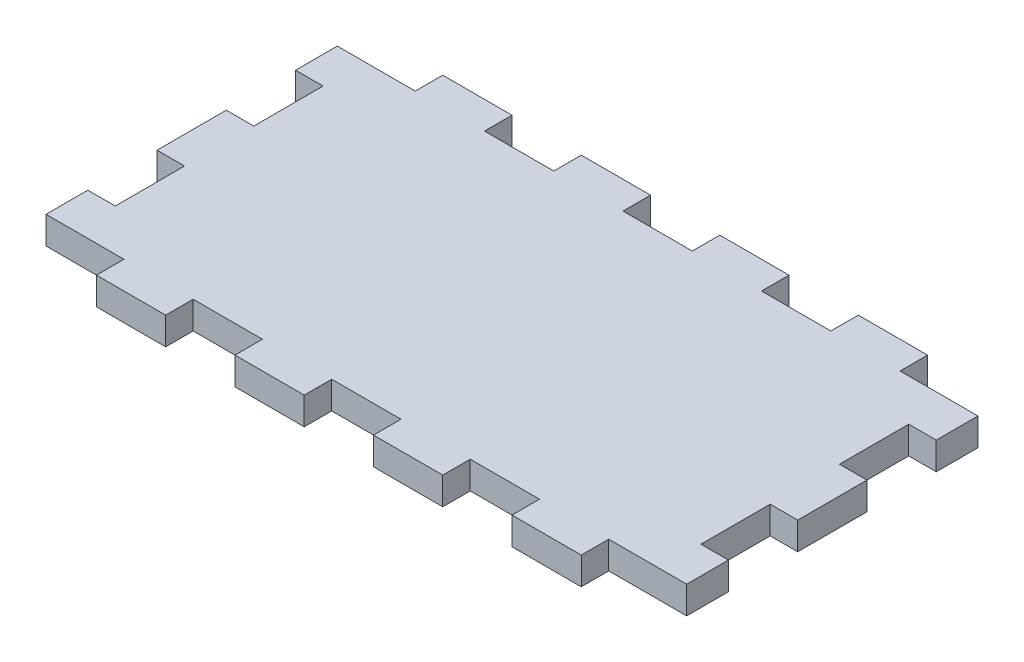
from build123d import *

# Parameters (mm, degrees)
SKETCH1_W           = 74
SKETCH1_H           = 40
BOSS_EXTRUDE1_DEPTH = 3.175
CUT_EXTRUDE1_REACH  = 86.179
SKETCH2_W           = 9
SKETCH2_H           = 3.175
SKETCH2_W_2         = 8
CUT_EXTRUDE2_REACH  = 86.179
SKETCH3_W           = 3.175
SKETCH3_H           = 8


with BuildPart() as part:
    # Sketch1 → Boss-Extrude1 (new body)
    with BuildSketch(Plane(origin=(0, 0, 0), x_dir=(1, 0, 0), z_dir=(0, 1, 0))):
        with Locations((37, -20)):
            Rectangle(SKETCH1_W, SKETCH1_H)
    extrude(amount=BOSS_EXTRUDE1_DEPTH)

    # Sketch2 → Cut-Extrude1 (cut, up to next)
    with BuildSketch(Plane(origin=(0, 3.175, 0), x_dir=(1, 0, 0), z_dir=(0, 1, 0)), mode=Mode.PRIVATE) as cut_extrude1_sk1:
        with Locations((4.5, -1.5875)):
            Rectangle(SKETCH2_W, SKETCH2_H)
    cut_extrude1_tool1 = extrude(cut_extrude1_sk1.sketch, amount=-CUT_EXTRUDE1_REACH, mode=Mode.PRIVATE) & part.part
    # Sketch2 → Cut-Extrude1 (cut, up to next)
    with BuildSketch(Plane(origin=(0, 3.175, 0), x_dir=(1, 0, 0), z_dir=(0, 1, 0)), mode=Mode.PRIVATE) as cut_extrude1_sk2:
        with Locations((37, -1.5875)):
            Rectangle(SKETCH2_W_2, SKETCH2_H)
    cut_extrude1_tool2 = extrude(cut_extrude1_sk2.sketch, amount=-CUT_EXTRUDE1_REACH, mode=Mode.PRIVATE) & part.part
    # Sketch2 → Cut-Extrude1 (cut, up to next)
    with BuildSketch(Plane(origin=(0, 3.175, 0), x_dir=(1, 0, 0), z_dir=(0, 1, 0)), mode=Mode.PRIVATE) as cut_extrude1_sk3:
        with Locations((53, -1.5875)):
            Rectangle(SKETCH2_W_2, SKETCH2_H)
    cut_extrude1_tool3 = extrude(cut_extrude1_sk3.sketch, amount=-CUT_EXTRUDE1_REACH, mode=Mode.PRIVATE) & part.part
    # Sketch2 → Cut-Extrude1 (cut, up to next)
    with BuildSketch(Plane(origin=(0, 3.175, 0), x_dir=(1, 0, 0), z_dir=(0, 1, 0)), mode=Mode.PRIVATE) as cut_extrude1_sk4:
        with Locations((69.5, -1.5875)):
            Rectangle(SKETCH2_W, SKETCH2_H)
    cut_extrude1_tool4 = extrude(cut_extrude1_sk4.sketch, amount=-CUT_EXTRUDE1_REACH, mode=Mode.PRIVATE) & part.part
    # Sketch2 → Cut-Extrude1 (cut, up to next)
    with BuildSketch(Plane(origin=(0, 3.175, 0), x_dir=(1, 0, 0), z_dir=(0, 1, 0)), mode=Mode.PRIVATE) as cut_extrude1_sk5:
        with Locations((21, -1.5875)):
            Rectangle(SKETCH2_W_2, SKETCH2_H)
    cut_extrude1_tool5 = extrude(cut_extrude1_sk5.sketch, amount=-CUT_EXTRUDE1_REACH, mode=Mode.PRIVATE) & part.part
    # Sketch2 → Cut-Extrude1 (cut, up to next)
    with BuildSketch(Plane(origin=(0, 3.175, 0), x_dir=(1, 0, 0), z_dir=(0, 1, 0)), mode=Mode.PRIVATE) as cut_extrude1_sk6:
        with Locations((37, -38.4125)):
            Rectangle(SKETCH2_W_2, SKETCH2_H)
    cut_extrude1_tool6 = extrude(cut_extrude1_sk6.sketch, amount=-CUT_EXTRUDE1_REACH, mode=Mode.PRIVATE) & part.part
    # Sketch2 → Cut-Extrude1 (cut, up to next)
    with BuildSketch(Plane(origin=(0, 3.175, 0), x_dir=(1, 0, 0), z_dir=(0, 1, 0)), mode=Mode.PRIVATE) as cut_extrude1_sk7:
        with Locations((21, -38.4125)):
            Rectangle(SKETCH2_W_2, SKETCH2_H)
    cut_extrude1_tool7 = extrude(cut_extrude1_sk7.sketch, amount=-CUT_EXTRUDE1_REACH, mode=Mode.PRIVATE) & part.part
    # Sketch2 → Cut-Extrude1 (cut, up to next)
    with BuildSketch(Plane(origin=(0, 3.175, 0), x_dir=(1, 0, 0), z_dir=(0, 1, 0)), mode=Mode.PRIVATE) as cut_extrude1_sk8:
        with Locations((4.5, -38.4125)):
            Rectangle(SKETCH2_W, SKETCH2_H)
    cut_extrude1_tool8 = extrude(cut_extrude1_sk8.sketch, amount=-CUT_EXTRUDE1_REACH, mode=Mode.PRIVATE) & part.part
    # Sketch2 → Cut-Extrude1 (cut, up to next)
    with BuildSketch(Plane(origin=(0, 3.175, 0), x_dir=(1, 0, 0), z_dir=(0, 1, 0)), mode=Mode.PRIVATE) as cut_extrude1_sk9:
        with Locations((69.5, -38.4125)):
            Rectangle(SKETCH2_W, SKETCH2_H)
    cut_extrude1_tool9 = extrude(cut_extrude1_sk9.sketch, amount=-CUT_EXTRUDE1_REACH, mode=Mode.PRIVATE) & part.part
    # Sketch2 → Cut-Extrude1 (cut, up to next)
    with BuildSketch(Plane(origin=(0, 3.175, 0), x_dir=(1, 0, 0), z_dir=(0, 1, 0)), mode=Mode.PRIVATE) as cut_extrude1_sk10:
        with Locations((53, -38.4125)):
            Rectangle(SKETCH2_W_2, SKETCH2_H)
    cut_extrude1_tool10 = extrude(cut_extrude1_sk10.sketch, amount=-CUT_EXTRUDE1_REACH, mode=Mode.PRIVATE) & part.part
    add(cut_extrude1_tool1.solids().sort_by_distance((4.5, 3.175, 1.5875))[0], mode=Mode.SUBTRACT)
    add(cut_extrude1_tool2.solids().sort_by_distance((37, 3.175, 1.5875))[0], mode=Mode.SUBTRACT)
    add(cut_extrude1_tool3.solids().sort_by_distance((53, 3.175, 1.5875))[0], mode=Mode.SUBTRACT)
    add(cut_extrude1_tool4.solids().sort_by_distance((69.5, 3.175, 1.5875))[0], mode=Mode.SUBTRACT)
    add(cut_extrude1_tool5.solids().sort_by_distance((21, 3.175, 1.5875))[0], mode=Mode.SUBTRACT)
    add(cut_extrude1_tool6.solids().sort_by_distance((37, 3.175, 38.4125))[0], mode=Mode.SUBTRACT)
    add(cut_extrude1_tool7.solids().sort_by_distance((21, 3.175, 38.4125))[0], mode=Mode.SUBTRACT)
    add(cut_extrude1_tool8.solids().sort_by_distance((4.5, 3.175, 38.4125))[0], mode=Mode.SUBTRACT)
    add(cut_extrude1_tool9.solids().sort_by_distance((69.5, 3.175, 38.4125))[0], mode=Mode.SUBTRACT)
    add(cut_extrude1_tool10.solids().sort_by_distance((53, 3.175, 38.4125))[0], mode=Mode.SUBTRACT)

    # Sketch3 → Cut-Extrude2 (cut, up to next)
    with BuildSketch(Plane(origin=(0, 3.175, 0), x_dir=(1, 0, 0), z_dir=(0, 1, 0)), mode=Mode.PRIVATE) as cut_extrude2_sk1:
        with Locations((1.5875, -28)):
            Rectangle(SKETCH3_W, SKETCH3_H)
    cut_extrude2_tool1 = extrude(cut_extrude2_sk1.sketch, amount=-CUT_EXTRUDE2_REACH, mode=Mode.PRIVATE) & part.part
    # Sketch3 → Cut-Extrude2 (cut, up to next)
    with BuildSketch(Plane(origin=(0, 3.175, 0), x_dir=(1, 0, 0), z_dir=(0, 1, 0)), mode=Mode.PRIVATE) as cut_extrude2_sk2:
        with Locations((1.5875, -12)):
            Rectangle(SKETCH3_W, SKETCH3_H)
    cut_extrude2_tool2 = extrude(cut_extrude2_sk2.sketch, amount=-CUT_EXTRUDE2_REACH, mode=Mode.PRIVATE) & part.part
    # Sketch3 → Cut-Extrude2 (cut, up to next)
    with BuildSketch(Plane(origin=(0, 3.175, 0), x_dir=(1, 0, 0), z_dir=(0, 1, 0)), mode=Mode.PRIVATE) as cut_extrude2_sk3:
        with Locations((72.4125, -28)):
            Rectangle(SKETCH3_W, SKETCH3_H)
    cut_extrude2_tool3 = extrude(cut_extrude2_sk3.sketch, amount=-CUT_EXTRUDE2_REACH, mode=Mode.PRIVATE) & part.part
    # Sketch3 → Cut-Extrude2 (cut, up to next)
    with BuildSketch(Plane(origin=(0, 3.175, 0), x_dir=(1, 0, 0), z_dir=(0, 1, 0)), mode=Mode.PRIVATE) as cut_extrude2_sk4:
        with Locations((72.4125, -12)):
            Rectangle(SKETCH3_W, SKETCH3_H)
    cut_extrude2_tool4 = extrude(cut_extrude2_sk4.sketch, amount=-CUT_EXTRUDE2_REACH, mode=Mode.PRIVATE) & part.part
    add(cut_extrude2_tool1.solids().sort_by_distance((1.5875, 3.175, 28))[0], mode=Mode.SUBTRACT)
    add(cut_extrude2_tool2.solids().sort_by_distance((1.5875, 3.175, 12))[0], mode=Mode.SUBTRACT)
    add(cut_extrude2_tool3.solids().sort_by_distance((72.4125, 3.175, 28))[0], mode=Mode.SUBTRACT)
    add(cut_extrude2_tool4.solids().sort_by_distance((72.4125, 3.175, 12))[0], mode=Mode.SUBTRACT)


solid = part.part
